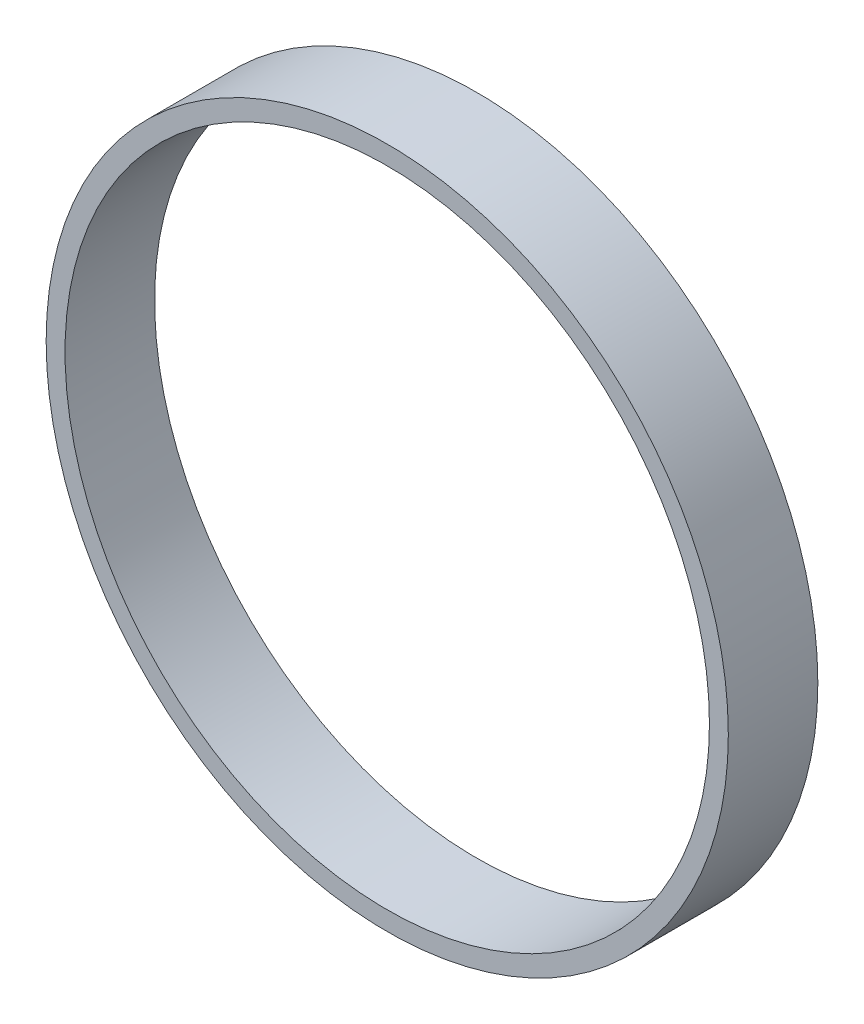
from build123d import *

# Parameters (mm, degrees)
SKETCH1_R           = 38.1
SKETCH1_R_2         = 35.99
BOSS_EXTRUDE1_DEPTH = 10


with BuildPart() as part:
    # Sketch1 → Boss-Extrude1 (new body)
    with BuildSketch(Plane.XY):
        Circle(SKETCH1_R)
        Circle(SKETCH1_R_2, mode=Mode.SUBTRACT)
    extrude(amount=BOSS_EXTRUDE1_DEPTH)


solid = part.part
